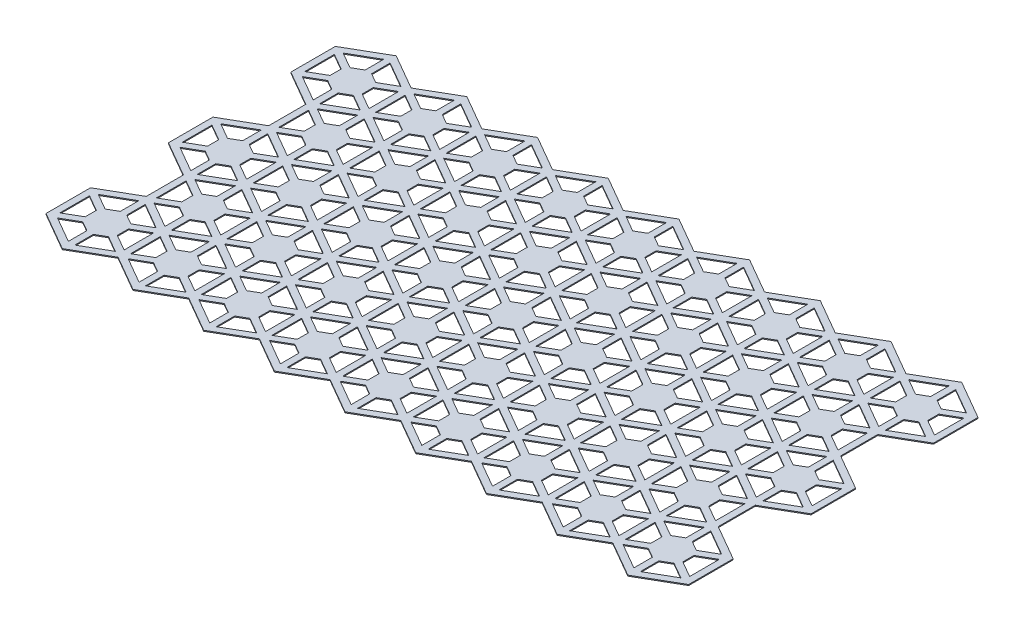
from build123d import *

# Parameters (mm, degrees)
BOSS_EXTRUDE1_DEPTH = 0.3
BOSS_EXTRUDE2_DEPTH = 0.3


with BuildPart() as part:
    # Sketch1 → Boss-Extrude1 (new body)
    with BuildSketch(Plane(origin=(0, 0, 0), x_dir=(1, 0, 0), z_dir=(0, 1, 0))):
        Polygon((-99, 45.600435733), (-100, 45.023085464), (-100, 43.873502692), (-100, 32.326497308), (-100, 31.17179677), (-99, 30.594446501), (-89, 24.820943809), (-89, 13.273938425), (-99, 7.500435733), (-100, 6.923085464), (-100, 5.773502692), (-100, -5.773502692), (-100, -6.92820323), (-99, -7.505553499), (-89, -13.279056191), (-89, -24.826061575), (-99, -30.599564267), (-100, -31.176914536), (-100, -32.326497308), (-100, -43.873502692), (-100, -45.02820323), (-99, -45.605553499), (-89, -51.379056191), (-88, -51.947005384), (-87.983716857, -51.947005384), (-87, -51.379056191), (-77, -45.605553499), (-67, -51.379056191), (-66.016283143, -51.947005384), (-65.983716857, -51.947005384), (-65, -51.379056191), (-55, -45.605553499), (-45, -51.379056191), (-44.016283143, -51.947005384), (-43.983716857, -51.947005384), (-43, -51.379056191), (-33, -45.605553499), (-23, -51.379056191), (-22.016283143, -51.947005384), (-21.983716857, -51.947005384), (-21, -51.379056191), (-11, -45.605553499), (-1, -51.379056191), (-0.016283143, -51.947005384), (0.016283143, -51.947005384), (1, -51.379056191), (11, -45.605553499), (21, -51.379056191), (21.983716857, -51.947005384), (22.016283143, -51.947005384), (23, -51.379056191), (33, -45.605553499), (43, -51.379056191), (43.983716857, -51.947005384), (44.016283143, -51.947005384), (45, -51.379056191), (55, -45.605553499), (65, -51.379056191), (65.983716857, -51.947005384), (66.016283143, -51.947005384), (67, -51.379056191), (77, -45.605553499), (87, -51.379056191), (87.983716857, -51.947005384), (88, -51.947005384), (89, -51.379056191), (99, -45.605553499), (100, -45.02820323), (100, -31.176914536), (99, -30.599564267), (95.380411851, -28.509794075), (89, -24.826061575), (89, -13.279056191), (95.380411851, -9.595323692), (99, -7.505553499), (100, -6.92820323), (100, 6.923085464), (99, 7.500435733), (89, 13.273938425), (89, 24.820943809), (99, 30.594446501), (100, 31.17179677), (100, 45.023085464), (99, 45.600435733), (89, 51.373938425), (88, 51.951288694), (87, 51.373938425), (77, 45.600435733), (67, 51.373938425), (66, 51.951288694), (65, 51.373938425), (55, 45.600435733), (45, 51.373938425), (44, 51.951288694), (43, 51.373938425), (33, 45.600435733), (23, 51.373938425), (22, 51.951288694), (21, 51.373938425), (11, 45.600435733), (1, 51.373938425), (0, 51.951288694), (-1, 51.373938425), (-11, 45.600435733), (-21, 51.373938425), (-22, 51.951288694), (-23, 51.373938425), (-33, 45.600435733), (-43, 51.373938425), (-44, 51.951288694), (-45, 51.373938425), (-55, 45.600435733), (-65, 51.373938425), (-66, 51.951288694), (-67, 51.373938425), (-77, 45.600435733), (-87, 51.373938425), (-88, 51.951288694), (-89, 51.373938425), align=None)
        Polygon((-98, -32.326497308), (-88, -26.552994616), (-78, -32.326497308), (-78, -43.873502692), (-88, -49.647005384), (-98, -43.873502692), align=None, mode=Mode.SUBTRACT)
        Polygon((-76, -32.326497308), (-66, -26.552994616), (-56, -32.326497308), (-56, -43.873502692), (-66, -49.647005384), (-76, -43.873502692), align=None, mode=Mode.SUBTRACT)
        Polygon((-87, -13.279056191), (-77, -7.505553499), (-67, -13.279056191), (-67, -24.826061575), (-77, -30.599564267), (-87, -24.826061575), align=None, mode=Mode.SUBTRACT)
        Polygon((-98, 5.773502692), (-88, 11.547005384), (-78, 5.773502692), (-78, -5.773502692), (-88, -11.547005384), (-98, -5.773502692), align=None, mode=Mode.SUBTRACT)
        Polygon((-76, 5.773502692), (-66, 11.547005384), (-56, 5.773502692), (-56, -5.773502692), (-66, -11.547005384), (-76, -5.773502692), align=None, mode=Mode.SUBTRACT)
        Polygon((-54, -32.326497308), (-44, -26.552994616), (-34, -32.326497308), (-34, -43.873502692), (-44, -49.647005384), (-54, -43.873502692), align=None, mode=Mode.SUBTRACT)
        Polygon((-32, -32.326497308), (-22, -26.552994616), (-12, -32.326497308), (-12, -43.873502692), (-22, -49.647005384), (-32, -43.873502692), align=None, mode=Mode.SUBTRACT)
        Polygon((-65, -13.279056191), (-55, -7.505553499), (-45, -13.279056191), (-45, -24.826061575), (-55, -30.599564267), (-65, -24.826061575), align=None, mode=Mode.SUBTRACT)
        Polygon((-54, 5.773502692), (-44, 11.547005384), (-34, 5.773502692), (-34, -5.773502692), (-44, -11.547005384), (-54, -5.773502692), align=None, mode=Mode.SUBTRACT)
        Polygon((-43, -13.279056191), (-33, -7.505553499), (-23, -13.279056191), (-23, -24.826061575), (-33, -30.599564267), (-43, -24.826061575), align=None, mode=Mode.SUBTRACT)
        Polygon((-21, -13.279056191), (-11, -7.505553499), (-1, -13.279056191), (-1, -24.826061575), (-11, -30.599564267), (-21, -24.826061575), align=None, mode=Mode.SUBTRACT)
        Polygon((-32, 5.773502692), (-22, 11.547005384), (-12, 5.773502692), (-12, -5.773502692), (-22, -11.547005384), (-32, -5.773502692), align=None, mode=Mode.SUBTRACT)
        Polygon((-10, -32.326497308), (0, -26.552994616), (10, -32.326497308), (10, -43.873502692), (0, -49.647005384), (-10, -43.873502692), align=None, mode=Mode.SUBTRACT)
        Polygon((12, -32.326497308), (22, -26.552994616), (32, -32.326497308), (32, -43.873502692), (22, -49.647005384), (12, -43.873502692), align=None, mode=Mode.SUBTRACT)
        Polygon((34, -32.326497308), (44, -26.552994616), (54, -32.326497308), (54, -43.873502692), (44, -49.647005384), (34, -43.873502692), align=None, mode=Mode.SUBTRACT)
        Polygon((1, -13.279056191), (11, -7.505553499), (21, -13.279056191), (21, -24.826061575), (11, -30.599564267), (1, -24.826061575), align=None, mode=Mode.SUBTRACT)
        Polygon((23, -13.279056191), (33, -7.505553499), (43, -13.279056191), (43, -24.826061575), (33, -30.599564267), (23, -24.826061575), align=None, mode=Mode.SUBTRACT)
        Polygon((56, -32.326497308), (66, -26.552994616), (76, -32.326497308), (76, -43.873502692), (66, -49.647005384), (56, -43.873502692), align=None, mode=Mode.SUBTRACT)
        Polygon((78, -32.326497308), (88, -26.552994616), (98, -32.326497308), (98, -43.873502692), (88, -49.647005384), (78, -43.873502692), align=None, mode=Mode.SUBTRACT)
        Polygon((45, -13.279056191), (55, -7.505553499), (65, -13.279056191), (65, -24.826061575), (55, -30.599564267), (45, -24.826061575), align=None, mode=Mode.SUBTRACT)
        Polygon((67, -13.279056191), (77, -7.505553499), (87, -13.279056191), (87, -24.826061575), (77, -30.599564267), (67, -24.826061575), align=None, mode=Mode.SUBTRACT)
        Polygon((-87, 24.820943809), (-77, 30.594446501), (-67, 24.820943809), (-67, 13.273938425), (-77, 7.500435733), (-87, 13.273938425), align=None, mode=Mode.SUBTRACT)
        Polygon((-98, 43.873502692), (-88, 49.647005384), (-78, 43.873502692), (-78, 32.326497308), (-88, 26.552994616), (-98, 32.326497308), align=None, mode=Mode.SUBTRACT)
        Polygon((-76, 43.873502692), (-66, 49.647005384), (-56, 43.873502692), (-56, 32.326497308), (-66, 26.552994616), (-76, 32.326497308), align=None, mode=Mode.SUBTRACT)
        Polygon((-65, 24.820943809), (-55, 30.594446501), (-45, 24.820943809), (-45, 13.273938425), (-55, 7.500435733), (-65, 13.273938425), align=None, mode=Mode.SUBTRACT)
        Polygon((-43, 24.820943809), (-33, 30.594446501), (-23, 24.820943809), (-23, 13.273938425), (-33, 7.500435733), (-43, 13.273938425), align=None, mode=Mode.SUBTRACT)
        Polygon((-21, 24.820943809), (-11, 30.594446501), (-1, 24.820943809), (-1, 13.273938425), (-11, 7.500435733), (-21, 13.273938425), align=None, mode=Mode.SUBTRACT)
        Polygon((-54, 43.873502692), (-44, 49.647005384), (-34, 43.873502692), (-34, 32.326497308), (-44, 26.552994616), (-54, 32.326497308), align=None, mode=Mode.SUBTRACT)
        Polygon((-32, 43.873502692), (-22, 49.647005384), (-12, 43.873502692), (-12, 32.326497308), (-22, 26.552994616), (-32, 32.326497308), align=None, mode=Mode.SUBTRACT)
        Polygon((-10, 5.773502692), (0, 11.547005384), (10, 5.773502692), (10, -5.773502692), (0, -11.547005384), (-10, -5.773502692), align=None, mode=Mode.SUBTRACT)
        Polygon((12, 5.773502692), (22, 11.547005384), (32, 5.773502692), (32, -5.773502692), (22, -11.547005384), (12, -5.773502692), align=None, mode=Mode.SUBTRACT)
        Polygon((1, 24.820943809), (11, 30.594446501), (21, 24.820943809), (21, 13.273938425), (11, 7.500435733), (1, 13.273938425), align=None, mode=Mode.SUBTRACT)
        Polygon((34, 5.773502692), (44, 11.547005384), (54, 5.773502692), (54, -5.773502692), (44, -11.547005384), (34, -5.773502692), align=None, mode=Mode.SUBTRACT)
        Polygon((23, 24.820943809), (33, 30.594446501), (43, 24.820943809), (43, 13.273938425), (33, 7.500435733), (23, 13.273938425), align=None, mode=Mode.SUBTRACT)
        Polygon((-10, 43.873502692), (0, 49.647005384), (10, 43.873502692), (10, 32.326497308), (0, 26.552994616), (-10, 32.326497308), align=None, mode=Mode.SUBTRACT)
        Polygon((12, 43.873502692), (22, 49.647005384), (32, 43.873502692), (32, 32.326497308), (22, 26.552994616), (12, 32.326497308), align=None, mode=Mode.SUBTRACT)
        Polygon((34, 43.873502692), (44, 49.647005384), (54, 43.873502692), (54, 32.326497308), (44, 26.552994616), (34, 32.326497308), align=None, mode=Mode.SUBTRACT)
        Polygon((56, 5.773502692), (66, 11.547005384), (76, 5.773502692), (76, -5.773502692), (66, -11.547005384), (56, -5.773502692), align=None, mode=Mode.SUBTRACT)
        Polygon((45, 24.820943809), (55, 30.594446501), (65, 24.820943809), (65, 13.273938425), (55, 7.500435733), (45, 13.273938425), align=None, mode=Mode.SUBTRACT)
        Polygon((67, 24.820943809), (77, 30.594446501), (87, 24.820943809), (87, 13.273938425), (77, 7.500435733), (67, 13.273938425), align=None, mode=Mode.SUBTRACT)
        Polygon((78, 5.773502692), (88, 11.547005384), (98, 5.773502692), (98, -5.773502692), (88, -11.547005384), (78, -5.773502692), align=None, mode=Mode.SUBTRACT)
        Polygon((56, 43.873502692), (66, 49.647005384), (76, 43.873502692), (76, 32.326497308), (66, 26.552994616), (56, 32.326497308), align=None, mode=Mode.SUBTRACT)
        Polygon((78, 43.873502692), (88, 49.647005384), (98, 43.873502692), (98, 32.326497308), (88, 26.552994616), (78, 32.326497308), align=None, mode=Mode.SUBTRACT)
    extrude(amount=BOSS_EXTRUDE1_DEPTH)

    # Sketch2 → Boss-Extrude2 (add)
    with BuildSketch(Plane(origin=(0, 0.3, 0), x_dir=(1, 0, 0), z_dir=(0, 1, 0))):
        Polygon((-1, 10.969655115), (-1, 5.196152423), (-4, 3.464101615), (-9, 6.350852961), (-10, 5.773502692), (-10, 4.618802154), (-5, 1.732050808), (-5, -1.732050808), (-10, -4.618802154), (-10, -5.773502692), (-9, -6.350852961), (-4, -3.464101615), (-1, -5.196152423), (-1, -10.969655115), (0, -11.547005384), (1, -10.969655115), (1, -5.196152423), (4, -3.464101615), (9, -6.350852961), (10, -5.773502692), (10, -4.618802154), (5, -1.732050808), (5, 1.732050808), (10, 4.618802154), (10, 5.773502692), (9, 6.350852961), (4, 3.464101615), (1, 5.196152423), (1, 10.969655115), (0, 11.547005384), align=None)
        Polygon((10, -8.082903769), (10, -13.856406461), (7, -15.588457268), (2, -12.701705922), (1, -13.279056191), (1, -14.43375673), (6, -17.320508076), (6, -20.784609691), (1, -23.671361037), (1, -24.826061575), (2, -25.403411844), (7, -22.516660498), (10, -24.248711306), (10, -30.022213998), (11, -30.599564267), (12, -30.022213998), (12, -24.248711306), (15, -22.516660498), (20, -25.403411844), (21, -24.826061575), (21, -23.671361037), (16, -20.784609691), (16, -17.320508076), (21, -14.43375673), (21, -13.279056191), (20, -12.701705922), (15, -15.588457268), (12, -13.856406461), (12, -8.082903769), (11, -7.505553499), align=None)
        Polygon((17, -1.732050808), (12, -4.618802154), (12, -5.773502692), (13, -6.350852961), (18, -3.464101615), (21, -5.196152423), (21, -10.969655115), (22, -11.547005384), (23, -10.969655115), (23, -5.196152423), (26, -3.464101615), (31, -6.350852961), (32, -5.773502692), (32, -4.618802154), (27, -1.732050808), (27, 1.732050808), (32, 4.618802154), (32, 5.773502692), (31, 6.350852961), (26, 3.464101615), (23, 5.196152423), (23, 10.969655115), (22, 11.547005384), (21, 10.969655115), (21, 5.196152423), (18, 3.464101615), (13, 6.350852961), (12, 5.773502692), (12, 4.618802154), (17, 1.732050808), align=None)
        Polygon((32, -8.082903769), (32, -13.856406461), (29, -15.588457268), (24, -12.701705922), (23, -13.279056191), (23, -14.43375673), (28, -17.320508076), (28, -20.784609691), (23, -23.671361037), (23, -24.826061575), (24, -25.403411844), (29, -22.516660498), (32, -24.248711306), (32, -30.022213998), (33, -30.599564267), (34, -30.022213998), (34, -24.248711306), (37, -22.516660498), (42, -25.403411844), (43, -24.826061575), (43, -23.671361037), (38, -20.784609691), (38, -17.320508076), (43, -14.43375673), (43, -13.279056191), (42, -12.701705922), (37, -15.588457268), (34, -13.856406461), (34, -8.082903769), (33, -7.505553499), align=None)
        Polygon((39, -1.732050808), (34, -4.618802154), (34, -5.773502692), (35, -6.350852961), (40, -3.464101615), (43, -5.196152423), (43, -10.969655115), (44, -11.547005384), (45, -10.969655115), (45, -5.196152423), (48, -3.464101615), (53, -6.350852961), (54, -5.773502692), (54, -4.618802154), (49, -1.732050808), (49, 1.732050808), (54, 4.618802154), (54, 5.773502692), (53, 6.350852961), (48, 3.464101615), (45, 5.196152423), (45, 10.969655115), (44, 11.547005384), (43, 10.969655115), (43, 5.196152423), (40, 3.464101615), (35, 6.350852961), (34, 5.773502692), (34, 4.618802154), (39, 1.732050808), align=None)
        Polygon((54, -8.082903769), (54, -13.856406461), (51, -15.588457268), (46, -12.701705922), (45, -13.279056191), (45, -14.43375673), (50, -17.320508076), (50, -20.784609691), (45, -23.671361037), (45, -24.826061575), (46, -25.403411844), (51, -22.516660498), (54, -24.248711306), (54, -30.022213998), (55, -30.599564267), (56, -30.022213998), (56, -24.248711306), (59, -22.516660498), (64, -25.403411844), (65, -24.826061575), (65, -23.671361037), (60, -20.784609691), (60, -17.320508076), (65, -14.43375673), (65, -13.279056191), (64, -12.701705922), (59, -15.588457268), (56, -13.856406461), (56, -8.082903769), (55, -7.505553499), align=None)
        Polygon((61, -1.732050808), (56, -4.618802154), (56, -5.773502692), (57, -6.350852961), (62, -3.464101615), (65, -5.196152423), (65, -10.969655115), (66, -11.547005384), (67, -10.969655115), (67, -5.196152423), (70, -3.464101615), (75, -6.350852961), (76, -5.773502692), (76, -4.618802154), (71, -1.732050808), (71, 1.732050808), (76, 4.618802154), (76, 5.773502692), (75, 6.350852961), (70, 3.464101615), (67, 5.196152423), (67, 10.969655115), (66, 11.547005384), (65, 10.969655115), (65, 5.196152423), (62, 3.464101615), (57, 6.350852961), (56, 5.773502692), (56, 4.618802154), (61, 1.732050808), align=None)
        Polygon((76, -8.082903769), (76, -13.856406461), (73, -15.588457268), (68, -12.701705922), (67, -13.279056191), (67, -14.43375673), (72, -17.320508076), (72, -20.784609691), (67, -23.671361037), (67, -24.826061575), (68, -25.403411844), (73, -22.516660498), (76, -24.248711306), (76, -30.022213998), (77, -30.599564267), (78, -30.022213998), (78, -24.248711306), (81, -22.516660498), (86, -25.403411844), (87, -24.826061575), (87, -23.671361037), (82, -20.784609691), (82, -17.320508076), (87, -14.43375673), (87, -13.279056191), (86, -12.701705922), (81, -15.588457268), (78, -13.856406461), (78, -8.082903769), (77, -7.505553499), align=None)
        Polygon((83, -1.732050808), (78, -4.618802154), (78, -5.773502692), (79, -6.350852961), (84, -3.464101615), (87, -5.196152423), (87, -10.969655115), (88, -11.547005384), (89, -10.969655115), (89, -5.196152423), (92, -3.464101615), (97, -6.350852961), (98, -5.773502692), (98, -4.618802154), (93, -1.732050808), (93, 1.732050808), (98, 4.618802154), (98, 5.773502692), (97, 6.350852961), (92, 3.464101615), (89, 5.196152423), (89, 10.969655115), (88, 11.547005384), (87, 10.969655115), (87, 5.196152423), (84, 3.464101615), (79, 6.350852961), (78, 5.773502692), (78, 4.618802154), (83, 1.732050808), align=None)
        Polygon((17, 36.367949192), (12, 33.481197846), (12, 32.326497308), (13, 31.749147039), (18, 34.635898385), (21, 32.903847577), (21, 27.130344885), (22, 26.552994616), (23, 27.130344885), (23, 32.903847577), (26, 34.635898385), (31, 31.749147039), (32, 32.326497308), (32, 33.481197846), (27, 36.367949192), (27, 39.832050808), (32, 42.718802154), (32, 43.873502692), (31, 44.450852961), (26, 41.564101615), (23, 43.296152423), (23, 49.069655115), (22, 49.647005384), (21, 49.069655115), (21, 43.296152423), (18, 41.564101615), (13, 44.450852961), (12, 43.873502692), (12, 42.718802154), (17, 39.832050808), align=None)
        Polygon((32, 30.017096231), (32, 24.243593539), (29, 22.511542732), (24, 25.398294078), (23, 24.820943809), (23, 23.66624327), (28, 20.779491924), (28, 17.315390309), (23, 14.428638963), (23, 13.273938425), (24, 12.696588156), (29, 15.583339502), (32, 13.851288694), (32, 8.077786002), (33, 7.500435733), (34, 8.077786002), (34, 13.851288694), (37, 15.583339502), (42, 12.696588156), (43, 13.273938425), (43, 14.428638963), (38, 17.315390309), (38, 20.779491924), (43, 23.66624327), (43, 24.820943809), (42, 25.398294078), (37, 22.511542732), (34, 24.243593539), (34, 30.017096231), (33, 30.594446501), align=None)
        Polygon((39, 36.367949192), (34, 33.481197846), (34, 32.326497308), (35, 31.749147039), (40, 34.635898385), (43, 32.903847577), (43, 27.130344885), (44, 26.552994616), (45, 27.130344885), (45, 32.903847577), (48, 34.635898385), (53, 31.749147039), (54, 32.326497308), (54, 33.481197846), (49, 36.367949192), (49, 39.832050808), (54, 42.718802154), (54, 43.873502692), (53, 44.450852961), (48, 41.564101615), (45, 43.296152423), (45, 49.069655115), (44, 49.647005384), (43, 49.069655115), (43, 43.296152423), (40, 41.564101615), (35, 44.450852961), (34, 43.873502692), (34, 42.718802154), (39, 39.832050808), align=None)
        Polygon((54, 30.017096231), (54, 24.243593539), (51, 22.511542732), (46, 25.398294078), (45, 24.820943809), (45, 23.66624327), (50, 20.779491924), (50, 17.315390309), (45, 14.428638963), (45, 13.273938425), (46, 12.696588156), (51, 15.583339502), (54, 13.851288694), (54, 8.077786002), (55, 7.500435733), (56, 8.077786002), (56, 13.851288694), (59, 15.583339502), (64, 12.696588156), (65, 13.273938425), (65, 14.428638963), (60, 17.315390309), (60, 20.779491924), (65, 23.66624327), (65, 24.820943809), (64, 25.398294078), (59, 22.511542732), (56, 24.243593539), (56, 30.017096231), (55, 30.594446501), align=None)
        Polygon((61, 36.367949192), (56, 33.481197846), (56, 32.326497308), (57, 31.749147039), (62, 34.635898385), (65, 32.903847577), (65, 27.130344885), (66, 26.552994616), (67, 27.130344885), (67, 32.903847577), (70, 34.635898385), (75, 31.749147039), (76, 32.326497308), (76, 33.481197846), (71, 36.367949192), (71, 39.832050808), (76, 42.718802154), (76, 43.873502692), (75, 44.450852961), (70, 41.564101615), (67, 43.296152423), (67, 49.069655115), (66, 49.647005384), (65, 49.069655115), (65, 43.296152423), (62, 41.564101615), (57, 44.450852961), (56, 43.873502692), (56, 42.718802154), (61, 39.832050808), align=None)
        Polygon((76, 30.017096231), (76, 24.243593539), (73, 22.511542732), (68, 25.398294078), (67, 24.820943809), (67, 23.66624327), (72, 20.779491924), (72, 17.315390309), (67, 14.428638963), (67, 13.273938425), (68, 12.696588156), (73, 15.583339502), (76, 13.851288694), (76, 8.077786002), (77, 7.500435733), (78, 8.077786002), (78, 13.851288694), (81, 15.583339502), (86, 12.696588156), (87, 13.273938425), (87, 14.428638963), (82, 17.315390309), (82, 20.779491924), (87, 23.66624327), (87, 24.820943809), (86, 25.398294078), (81, 22.511542732), (78, 24.243593539), (78, 30.017096231), (77, 30.594446501), align=None)
        Polygon((83, 36.367949192), (78, 33.481197846), (78, 32.326497308), (79, 31.749147039), (84, 34.635898385), (87, 32.903847577), (87, 27.130344885), (88, 26.552994616), (89, 27.130344885), (89, 32.903847577), (92, 34.635898385), (97, 31.749147039), (98, 32.326497308), (98, 33.481197846), (93, 36.367949192), (93, 39.832050808), (98, 42.718802154), (98, 43.873502692), (97, 44.450852961), (92, 41.564101615), (89, 43.296152423), (89, 49.069655115), (88, 49.647005384), (87, 49.069655115), (87, 43.296152423), (84, 41.564101615), (79, 44.450852961), (78, 43.873502692), (78, 42.718802154), (83, 39.832050808), align=None)
        Polygon((-5, 36.367949192), (-10, 33.481197846), (-10, 32.326497308), (-9, 31.749147039), (-4, 34.635898385), (-1, 32.903847577), (-1, 27.130344885), (0, 26.552994616), (1, 27.130344885), (1, 32.903847577), (4, 34.635898385), (9, 31.749147039), (10, 32.326497308), (10, 33.481197846), (5, 36.367949192), (5, 39.832050808), (10, 42.718802154), (10, 43.873502692), (9, 44.450852961), (4, 41.564101615), (1, 43.296152423), (1, 49.069655115), (0, 49.647005384), (-1, 49.069655115), (-1, 43.296152423), (-4, 41.564101615), (-9, 44.450852961), (-10, 43.873502692), (-10, 42.718802154), (-5, 39.832050808), align=None)
        Polygon((10, 30.017096231), (10, 24.243593539), (7, 22.511542732), (2, 25.398294078), (1, 24.820943809), (1, 23.66624327), (6, 20.779491924), (6, 17.315390309), (1, 14.428638963), (1, 13.273938425), (2, 12.696588156), (7, 15.583339502), (10, 13.851288694), (10, 8.077786002), (11, 7.500435733), (12, 8.077786002), (12, 13.851288694), (15, 15.583339502), (20, 12.696588156), (21, 13.273938425), (21, 14.428638963), (16, 17.315390309), (16, 20.779491924), (21, 23.66624327), (21, 24.820943809), (20, 25.398294078), (15, 22.511542732), (12, 24.243593539), (12, 30.017096231), (11, 30.594446501), align=None)
        Polygon((-27, -1.732050808), (-32, -4.618802154), (-32, -5.773502692), (-31, -6.350852961), (-26, -3.464101615), (-23, -5.196152423), (-23, -10.969655115), (-22, -11.547005384), (-21, -10.969655115), (-21, -5.196152423), (-18, -3.464101615), (-13, -6.350852961), (-12, -5.773502692), (-12, -4.618802154), (-17, -1.732050808), (-17, 1.732050808), (-12, 4.618802154), (-12, 5.773502692), (-13, 6.350852961), (-18, 3.464101615), (-21, 5.196152423), (-21, 10.969655115), (-22, 11.547005384), (-23, 10.969655115), (-23, 5.196152423), (-26, 3.464101615), (-31, 6.350852961), (-32, 5.773502692), (-32, 4.618802154), (-27, 1.732050808), align=None)
        Polygon((-12, -8.082903769), (-12, -13.856406461), (-15, -15.588457268), (-20, -12.701705922), (-21, -13.279056191), (-21, -14.43375673), (-16, -17.320508076), (-16, -20.784609691), (-21, -23.671361037), (-21, -24.826061575), (-20, -25.403411844), (-15, -22.516660498), (-12, -24.248711306), (-12, -30.022213998), (-11, -30.599564267), (-10, -30.022213998), (-10, -24.248711306), (-7, -22.516660498), (-2, -25.403411844), (-1, -24.826061575), (-1, -23.671361037), (-6, -20.784609691), (-6, -17.320508076), (-1, -14.43375673), (-1, -13.279056191), (-2, -12.701705922), (-7, -15.588457268), (-10, -13.856406461), (-10, -8.082903769), (-11, -7.505553499), align=None)
        Polygon((-49, -1.732050808), (-54, -4.618802154), (-54, -5.773502692), (-53, -6.350852961), (-48, -3.464101615), (-45, -5.196152423), (-45, -10.969655115), (-44, -11.547005384), (-43, -10.969655115), (-43, -5.196152423), (-40, -3.464101615), (-35, -6.350852961), (-34, -5.773502692), (-34, -4.618802154), (-39, -1.732050808), (-39, 1.732050808), (-34, 4.618802154), (-34, 5.773502692), (-35, 6.350852961), (-40, 3.464101615), (-43, 5.196152423), (-43, 10.969655115), (-44, 11.547005384), (-45, 10.969655115), (-45, 5.196152423), (-48, 3.464101615), (-53, 6.350852961), (-54, 5.773502692), (-54, 4.618802154), (-49, 1.732050808), align=None)
        Polygon((-34, -8.082903769), (-34, -13.856406461), (-37, -15.588457268), (-42, -12.701705922), (-43, -13.279056191), (-43, -14.43375673), (-38, -17.320508076), (-38, -20.784609691), (-43, -23.671361037), (-43, -24.826061575), (-42, -25.403411844), (-37, -22.516660498), (-34, -24.248711306), (-34, -30.022213998), (-33, -30.599564267), (-32, -30.022213998), (-32, -24.248711306), (-29, -22.516660498), (-24, -25.403411844), (-23, -24.826061575), (-23, -23.671361037), (-28, -20.784609691), (-28, -17.320508076), (-23, -14.43375673), (-23, -13.279056191), (-24, -12.701705922), (-29, -15.588457268), (-32, -13.856406461), (-32, -8.082903769), (-33, -7.505553499), align=None)
        Polygon((-71, -1.732050808), (-76, -4.618802154), (-76, -5.773502692), (-75, -6.350852961), (-70, -3.464101615), (-67, -5.196152423), (-67, -10.969655115), (-66, -11.547005384), (-65, -10.969655115), (-65, -5.196152423), (-62, -3.464101615), (-57, -6.350852961), (-56, -5.773502692), (-56, -4.618802154), (-61, -1.732050808), (-61, 1.732050808), (-56, 4.618802154), (-56, 5.773502692), (-57, 6.350852961), (-62, 3.464101615), (-65, 5.196152423), (-65, 10.969655115), (-66, 11.547005384), (-67, 10.969655115), (-67, 5.196152423), (-70, 3.464101615), (-75, 6.350852961), (-76, 5.773502692), (-76, 4.618802154), (-71, 1.732050808), align=None)
        Polygon((-56, -8.082903769), (-56, -13.856406461), (-59, -15.588457268), (-64, -12.701705922), (-65, -13.279056191), (-65, -14.43375673), (-60, -17.320508076), (-60, -20.784609691), (-65, -23.671361037), (-65, -24.826061575), (-64, -25.403411844), (-59, -22.516660498), (-56, -24.248711306), (-56, -30.022213998), (-55, -30.599564267), (-54, -30.022213998), (-54, -24.248711306), (-51, -22.516660498), (-46, -25.403411844), (-45, -24.826061575), (-45, -23.671361037), (-50, -20.784609691), (-50, -17.320508076), (-45, -14.43375673), (-45, -13.279056191), (-46, -12.701705922), (-51, -15.588457268), (-54, -13.856406461), (-54, -8.082903769), (-55, -7.505553499), align=None)
        Polygon((-93, -1.732050808), (-98, -4.618802154), (-98, -5.773502692), (-97, -6.350852961), (-92, -3.464101615), (-89, -5.196152423), (-89, -10.969655115), (-88, -11.547005384), (-87, -10.969655115), (-87, -5.196152423), (-84, -3.464101615), (-79, -6.350852961), (-78, -5.773502692), (-78, -4.618802154), (-83, -1.732050808), (-83, 1.732050808), (-78, 4.618802154), (-78, 5.773502692), (-79, 6.350852961), (-84, 3.464101615), (-87, 5.196152423), (-87, 10.969655115), (-88, 11.547005384), (-89, 10.969655115), (-89, 5.196152423), (-92, 3.464101615), (-97, 6.350852961), (-98, 5.773502692), (-98, 4.618802154), (-93, 1.732050808), align=None)
        Polygon((-78, -8.082903769), (-78, -13.856406461), (-81, -15.588457268), (-86, -12.701705922), (-87, -13.279056191), (-87, -14.43375673), (-82, -17.320508076), (-82, -20.784609691), (-87, -23.671361037), (-87, -24.826061575), (-86, -25.403411844), (-81, -22.516660498), (-78, -24.248711306), (-78, -30.022213998), (-77, -30.599564267), (-76, -30.022213998), (-76, -24.248711306), (-73, -22.516660498), (-68, -25.403411844), (-67, -24.826061575), (-67, -23.671361037), (-72, -20.784609691), (-72, -17.320508076), (-67, -14.43375673), (-67, -13.279056191), (-68, -12.701705922), (-73, -15.588457268), (-76, -13.856406461), (-76, -8.082903769), (-77, -7.505553499), align=None)
        Polygon((-27, 36.367949192), (-32, 33.481197846), (-32, 32.326497308), (-31, 31.749147039), (-26, 34.635898385), (-23, 32.903847577), (-23, 27.130344885), (-22, 26.552994616), (-21, 27.130344885), (-21, 32.903847577), (-18, 34.635898385), (-13, 31.749147039), (-12, 32.326497308), (-12, 33.481197846), (-17, 36.367949192), (-17, 39.832050808), (-12, 42.718802154), (-12, 43.873502692), (-13, 44.450852961), (-18, 41.564101615), (-21, 43.296152423), (-21, 49.069655115), (-22, 49.647005384), (-23, 49.069655115), (-23, 43.296152423), (-26, 41.564101615), (-31, 44.450852961), (-32, 43.873502692), (-32, 42.718802154), (-27, 39.832050808), align=None)
        Polygon((-12, 30.017096231), (-12, 24.243593539), (-15, 22.511542732), (-20, 25.398294078), (-21, 24.820943809), (-21, 23.66624327), (-16, 20.779491924), (-16, 17.315390309), (-21, 14.428638963), (-21, 13.273938425), (-20, 12.696588156), (-15, 15.583339502), (-12, 13.851288694), (-12, 8.077786002), (-11, 7.500435733), (-10, 8.077786002), (-10, 13.851288694), (-7, 15.583339502), (-2, 12.696588156), (-1, 13.273938425), (-1, 14.428638963), (-6, 17.315390309), (-6, 20.779491924), (-1, 23.66624327), (-1, 24.820943809), (-2, 25.398294078), (-7, 22.511542732), (-10, 24.243593539), (-10, 30.017096231), (-11, 30.594446501), align=None)
        Polygon((-49, 36.367949192), (-54, 33.481197846), (-54, 32.326497308), (-53, 31.749147039), (-48, 34.635898385), (-45, 32.903847577), (-45, 27.130344885), (-44, 26.552994616), (-43, 27.130344885), (-43, 32.903847577), (-40, 34.635898385), (-35, 31.749147039), (-34, 32.326497308), (-34, 33.481197846), (-39, 36.367949192), (-39, 39.832050808), (-34, 42.718802154), (-34, 43.873502692), (-35, 44.450852961), (-40, 41.564101615), (-43, 43.296152423), (-43, 49.069655115), (-44, 49.647005384), (-45, 49.069655115), (-45, 43.296152423), (-48, 41.564101615), (-53, 44.450852961), (-54, 43.873502692), (-54, 42.718802154), (-49, 39.832050808), align=None)
        Polygon((-34, 30.017096231), (-34, 24.243593539), (-37, 22.511542732), (-42, 25.398294078), (-43, 24.820943809), (-43, 23.66624327), (-38, 20.779491924), (-38, 17.315390309), (-43, 14.428638963), (-43, 13.273938425), (-42, 12.696588156), (-37, 15.583339502), (-34, 13.851288694), (-34, 8.077786002), (-33, 7.500435733), (-32, 8.077786002), (-32, 13.851288694), (-29, 15.583339502), (-24, 12.696588156), (-23, 13.273938425), (-23, 14.428638963), (-28, 17.315390309), (-28, 20.779491924), (-23, 23.66624327), (-23, 24.820943809), (-24, 25.398294078), (-29, 22.511542732), (-32, 24.243593539), (-32, 30.017096231), (-33, 30.594446501), align=None)
        Polygon((-71, 36.367949192), (-76, 33.481197846), (-76, 32.326497308), (-75, 31.749147039), (-70, 34.635898385), (-67, 32.903847577), (-67, 27.130344885), (-66, 26.552994616), (-65, 27.130344885), (-65, 32.903847577), (-62, 34.635898385), (-57, 31.749147039), (-56, 32.326497308), (-56, 33.481197846), (-61, 36.367949192), (-61, 39.832050808), (-56, 42.718802154), (-56, 43.873502692), (-57, 44.450852961), (-62, 41.564101615), (-65, 43.296152423), (-65, 49.069655115), (-66, 49.647005384), (-67, 49.069655115), (-67, 43.296152423), (-70, 41.564101615), (-75, 44.450852961), (-76, 43.873502692), (-76, 42.718802154), (-71, 39.832050808), align=None)
        Polygon((-56, 30.017096231), (-56, 24.243593539), (-59, 22.511542732), (-64, 25.398294078), (-65, 24.820943809), (-65, 23.66624327), (-60, 20.779491924), (-60, 17.315390309), (-65, 14.428638963), (-65, 13.273938425), (-64, 12.696588156), (-59, 15.583339502), (-56, 13.851288694), (-56, 8.077786002), (-55, 7.500435733), (-54, 8.077786002), (-54, 13.851288694), (-51, 15.583339502), (-46, 12.696588156), (-45, 13.273938425), (-45, 14.428638963), (-50, 17.315390309), (-50, 20.779491924), (-45, 23.66624327), (-45, 24.820943809), (-46, 25.398294078), (-51, 22.511542732), (-54, 24.243593539), (-54, 30.017096231), (-55, 30.594446501), align=None)
        Polygon((-93, 36.367949192), (-98, 33.481197846), (-98, 32.326497308), (-97, 31.749147039), (-92, 34.635898385), (-89, 32.903847577), (-89, 27.130344885), (-88, 26.552994616), (-87, 27.130344885), (-87, 32.903847577), (-84, 34.635898385), (-79, 31.749147039), (-78, 32.326497308), (-78, 33.481197846), (-83, 36.367949192), (-83, 39.832050808), (-78, 42.718802154), (-78, 43.873502692), (-79, 44.450852961), (-84, 41.564101615), (-87, 43.296152423), (-87, 49.069655115), (-88, 49.647005384), (-89, 49.069655115), (-89, 43.296152423), (-92, 41.564101615), (-97, 44.450852961), (-98, 43.873502692), (-98, 42.718802154), (-93, 39.832050808), align=None)
        Polygon((-78, 30.017096231), (-78, 24.243593539), (-81, 22.511542732), (-86, 25.398294078), (-87, 24.820943809), (-87, 23.66624327), (-82, 20.779491924), (-82, 17.315390309), (-87, 14.428638963), (-87, 13.273938425), (-86, 12.696588156), (-81, 15.583339502), (-78, 13.851288694), (-78, 8.077786002), (-77, 7.500435733), (-76, 8.077786002), (-76, 13.851288694), (-73, 15.583339502), (-68, 12.696588156), (-67, 13.273938425), (-67, 14.428638963), (-72, 17.315390309), (-72, 20.779491924), (-67, 23.66624327), (-67, 24.820943809), (-68, 25.398294078), (-73, 22.511542732), (-76, 24.243593539), (-76, 30.017096231), (-77, 30.594446501), align=None)
        Polygon((-71, -39.832050808), (-76, -42.718802154), (-76, -43.873502692), (-75, -44.450852961), (-70, -41.564101615), (-67, -43.296152423), (-67, -49.069655115), (-66, -49.647005384), (-65, -49.069655115), (-65, -43.296152423), (-62, -41.564101615), (-57, -44.450852961), (-56, -43.873502692), (-56, -42.718802154), (-61, -39.832050808), (-61, -36.367949192), (-56, -33.481197846), (-56, -32.326497308), (-57, -31.749147039), (-62, -34.635898385), (-65, -32.903847577), (-65, -27.130344885), (-66, -26.552994616), (-67, -27.130344885), (-67, -32.903847577), (-70, -34.635898385), (-75, -31.749147039), (-76, -32.326497308), (-76, -33.481197846), (-71, -36.367949192), align=None)
        Polygon((-49, -39.832050808), (-54, -42.718802154), (-54, -43.873502692), (-53, -44.450852961), (-48, -41.564101615), (-45, -43.296152423), (-45, -49.069655115), (-44, -49.647005384), (-43, -49.069655115), (-43, -43.296152423), (-40, -41.564101615), (-35, -44.450852961), (-34, -43.873502692), (-34, -42.718802154), (-39, -39.832050808), (-39, -36.367949192), (-34, -33.481197846), (-34, -32.326497308), (-35, -31.749147039), (-40, -34.635898385), (-43, -32.903847577), (-43, -27.130344885), (-44, -26.552994616), (-45, -27.130344885), (-45, -32.903847577), (-48, -34.635898385), (-53, -31.749147039), (-54, -32.326497308), (-54, -33.481197846), (-49, -36.367949192), align=None)
        Polygon((-27, -39.832050808), (-32, -42.718802154), (-32, -43.873502692), (-31, -44.450852961), (-26, -41.564101615), (-23, -43.296152423), (-23, -49.069655115), (-22, -49.647005384), (-21, -49.069655115), (-21, -43.296152423), (-18, -41.564101615), (-13, -44.450852961), (-12, -43.873502692), (-12, -42.718802154), (-17, -39.832050808), (-17, -36.367949192), (-12, -33.481197846), (-12, -32.326497308), (-13, -31.749147039), (-18, -34.635898385), (-21, -32.903847577), (-21, -27.130344885), (-22, -26.552994616), (-23, -27.130344885), (-23, -32.903847577), (-26, -34.635898385), (-31, -31.749147039), (-32, -32.326497308), (-32, -33.481197846), (-27, -36.367949192), align=None)
        Polygon((-5, -39.832050808), (-10, -42.718802154), (-10, -43.873502692), (-9, -44.450852961), (-4, -41.564101615), (-1, -43.296152423), (-1, -49.069655115), (0, -49.647005384), (1, -49.069655115), (1, -43.296152423), (4, -41.564101615), (9, -44.450852961), (10, -43.873502692), (10, -42.718802154), (5, -39.832050808), (5, -36.367949192), (10, -33.481197846), (10, -32.326497308), (9, -31.749147039), (4, -34.635898385), (1, -32.903847577), (1, -27.130344885), (0, -26.552994616), (-1, -27.130344885), (-1, -32.903847577), (-4, -34.635898385), (-9, -31.749147039), (-10, -32.326497308), (-10, -33.481197846), (-5, -36.367949192), align=None)
        Polygon((17, -39.832050808), (12, -42.718802154), (12, -43.873502692), (13, -44.450852961), (18, -41.564101615), (21, -43.296152423), (21, -49.069655115), (22, -49.647005384), (23, -49.069655115), (23, -43.296152423), (26, -41.564101615), (31, -44.450852961), (32, -43.873502692), (32, -42.718802154), (27, -39.832050808), (27, -36.367949192), (32, -33.481197846), (32, -32.326497308), (31, -31.749147039), (26, -34.635898385), (23, -32.903847577), (23, -27.130344885), (22, -26.552994616), (21, -27.130344885), (21, -32.903847577), (18, -34.635898385), (13, -31.749147039), (12, -32.326497308), (12, -33.481197846), (17, -36.367949192), align=None)
        Polygon((39, -39.832050808), (34, -42.718802154), (34, -43.873502692), (35, -44.450852961), (40, -41.564101615), (43, -43.296152423), (43, -49.069655115), (44, -49.647005384), (45, -49.069655115), (45, -43.296152423), (48, -41.564101615), (53, -44.450852961), (54, -43.873502692), (54, -42.718802154), (49, -39.832050808), (49, -36.367949192), (54, -33.481197846), (54, -32.326497308), (53, -31.749147039), (48, -34.635898385), (45, -32.903847577), (45, -27.130344885), (44, -26.552994616), (43, -27.130344885), (43, -32.903847577), (40, -34.635898385), (35, -31.749147039), (34, -32.326497308), (34, -33.481197846), (39, -36.367949192), align=None)
        Polygon((61, -39.832050808), (56, -42.718802154), (56, -43.873502692), (57, -44.450852961), (62, -41.564101615), (65, -43.296152423), (65, -49.069655115), (66, -49.647005384), (67, -49.069655115), (67, -43.296152423), (70, -41.564101615), (75, -44.450852961), (76, -43.873502692), (76, -42.718802154), (71, -39.832050808), (71, -36.367949192), (76, -33.481197846), (76, -32.326497308), (75, -31.749147039), (70, -34.635898385), (67, -32.903847577), (67, -27.130344885), (66, -26.552994616), (65, -27.130344885), (65, -32.903847577), (62, -34.635898385), (57, -31.749147039), (56, -32.326497308), (56, -33.481197846), (61, -36.367949192), align=None)
        Polygon((83, -39.832050808), (78, -42.718802154), (78, -43.873502692), (79, -44.450852961), (84, -41.564101615), (87, -43.296152423), (87, -49.069655115), (88, -49.647005384), (89, -49.069655115), (89, -43.296152423), (92, -41.564101615), (97, -44.450852961), (98, -43.873502692), (98, -42.718802154), (93, -39.832050808), (93, -36.367949192), (98, -33.481197846), (98, -32.326497308), (97, -31.749147039), (92, -34.635898385), (89, -32.903847577), (89, -27.130344885), (88, -26.552994616), (87, -27.130344885), (87, -32.903847577), (84, -34.635898385), (79, -31.749147039), (78, -32.326497308), (78, -33.481197846), (83, -36.367949192), align=None)
        Polygon((-93, -39.832050808), (-98, -42.718802154), (-98, -43.873502692), (-97, -44.450852961), (-92, -41.564101615), (-89, -43.296152423), (-89, -49.069655115), (-88, -49.647005384), (-87, -49.069655115), (-87, -43.296152423), (-84, -41.564101615), (-79, -44.450852961), (-78, -43.873502692), (-78, -42.718802154), (-83, -39.832050808), (-83, -36.367949192), (-78, -33.481197846), (-78, -32.326497308), (-79, -31.749147039), (-84, -34.635898385), (-87, -32.903847577), (-87, -27.130344885), (-88, -26.552994616), (-89, -27.130344885), (-89, -32.903847577), (-92, -34.635898385), (-97, -31.749147039), (-98, -32.326497308), (-98, -33.481197846), (-93, -36.367949192), align=None)
    extrude(amount=-BOSS_EXTRUDE2_DEPTH)


solid = part.part
